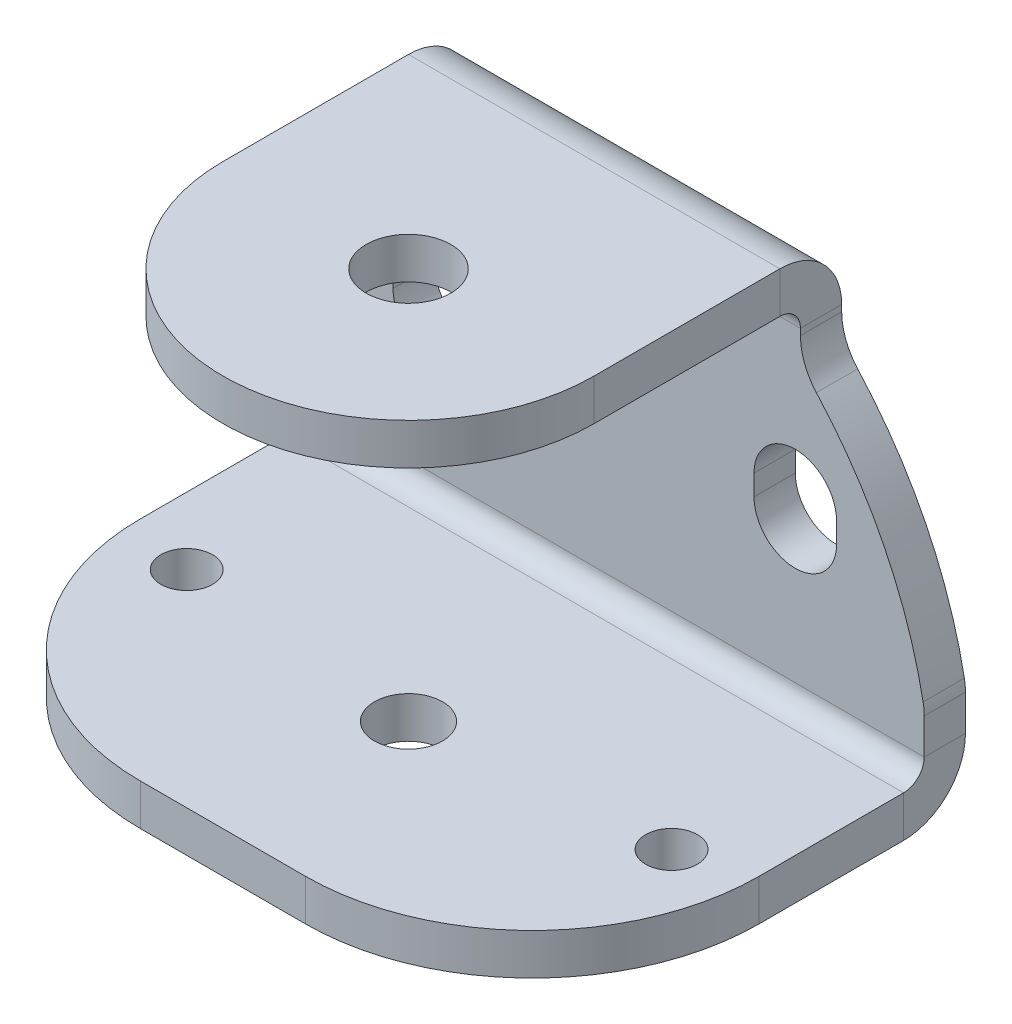
from build123d import *

# Parameters (mm, degrees)
BRIDA_BASE1_DEPTH                = 2
REDONDEO3MM_R                    = 3
BRIDA_DE_ARISTA1_STRIP_W         = 10
BRIDA_DE_ARISTA1_STRIP_H         = 2
BRIDA_DE_ARISTA1_STRIP_CUT_DEPTH = 30
BRIDA_DE_ARISTA1_DEPTH           = 30
BRIDA_DE_ARISTA2_STRIP_W         = 10
BRIDA_DE_ARISTA2_STRIP_H         = 2
BRIDA_DE_ARISTA2_STRIP_CUT_DEPTH = 18
BRIDA_DE_ARISTA2_DEPTH           = 18
BRIDA_START                      = 2
BRIDA_DE_ARISTA2_FLAT_DEPTH      = 2
CORTAR_EXTRUIR6_REACH            = 43.255
REDONDEO11MM_R                   = 11
TALADRO_ROSCADO_M32_D            = 2.5
TALADRO_ROSCADO_M32_DEPTH        = 20.65
TALADRO_ROSCADO_M32_TIP          = 0.751075774
CROQUIS41_R                      = 2.05
CORTAR_EXTRUIR9_DEPTH            = 2
TALADRO_ROSCADO_M41_D            = 3.3


# Sheet-metal steps are written as plain solids
with BuildPart() as part:
    # Croquis1 → Brida base1 (new body)
    with BuildSketch(Plane.XY):
        with BuildLine():
            Line((0, 0), (30, 0))
            Line((30, 0), (30, 3))
            ThreePointArc((30, 3), (27.886584846, 9.212566007), (24, 14.5))
            Line((24, 14.5), (24, 17))
            Line((24, 17), (6, 17))
            Line((6, 17), (6, 14.5))
            ThreePointArc((6, 14.5), (2.113415154, 9.212566007), (0, 3))
            Line((0, 3), (0, 0))
        make_face()
    extrude(amount=-BRIDA_BASE1_DEPTH)

    # Redondeo3mm
    redondeo3mm_edges = [part.edges().sort_by_distance(p)[0] for p in [
        (0, 3, -1),
        (6, 14.5, -1),
        (24, 14.5, -1),
        (30, 3, -1),
    ]]
    fillet(redondeo3mm_edges, radius=REDONDEO3MM_R)

    # Brida de arista1 strip (across the edge) → Brida de arista1 strip cut (cut)
    with BuildSketch(Plane.YZ):
        with Locations((-4, -1)):
            Rectangle(BRIDA_DE_ARISTA1_STRIP_W, BRIDA_DE_ARISTA1_STRIP_H)
    extrude(amount=BRIDA_DE_ARISTA1_STRIP_CUT_DEPTH, mode=Mode.SUBTRACT)

    # Brida de arista1 section (across the edge) → Brida de arista1 (add)
    with BuildSketch(Plane.YZ):
        with BuildLine():
            Line((-2, 1), (-2, 19))
            Line((-2, 19), (0, 19))
            Line((0, 19), (0, 1))
            ThreePointArc((0, 1), (0.292893219, 0.292893219), (1, 0))
            Line((1, 0), (1, -2))
            ThreePointArc((1, -2), (-1.121320344, -1.121320344), (-2, 1))
        make_face()
    extrude(amount=BRIDA_DE_ARISTA1_DEPTH)

    # Brida de arista2 strip (across the edge) → Brida de arista2 strip cut (cut)
    with BuildSketch(Plane(origin=(24, 17, 0), x_dir=(0, -1, 0), z_dir=(-1, 0, 0))):
        with Locations((-4, -1)):
            Rectangle(BRIDA_DE_ARISTA2_STRIP_W, BRIDA_DE_ARISTA2_STRIP_H)
    extrude(amount=BRIDA_DE_ARISTA2_STRIP_CUT_DEPTH, mode=Mode.SUBTRACT)

    # Brida de arista2 bend section (across the edge) → Brida de arista2 (add)
    with BuildSketch(Plane(origin=(24, 17, 0), x_dir=(0, -1, 0), z_dir=(-1, 0, 0))):
        with BuildLine():
            Line((-2, 1), (0, 1))
            ThreePointArc((0, 1), (0.292893219, 0.292893219), (1, 0))
            Line((1, 0), (1, -2))
            ThreePointArc((1, -2), (-1.121320344, -1.121320344), (-2, 1))
        make_face()
    extrude(amount=BRIDA_DE_ARISTA2_DEPTH)

    # Brida de arista2 profile (on flange) → Brida de arista2 flat (add)
    with BuildSketch(Plane(origin=(0, 17, 0), x_dir=(-1, 0, 0), z_dir=(0, 1, 0)).offset(BRIDA_START)):
        with BuildLine():
            ThreePointArc((-6, 10), (-15, 19), (-24, 10))
            Line((-24, 10), (-24, 1))
            Line((-24, 1), (-6, 1))
            Line((-6, 1), (-6, 10))
        make_face()
    extrude(amount=-BRIDA_DE_ARISTA2_FLAT_DEPTH)

    # Croquis26 → Cortar-Extruir6 (cut, up to next)
    with BuildSketch(Plane(origin=(0, 0, -2), x_dir=(-1, 0, 0), z_dir=(0, 0, -1)), mode=Mode.PRIVATE) as cortar_extruir6_sk1:
        with BuildLine():
            Line((-8.25, 7.8), (-8.25, 8.8))
            ThreePointArc((-8.25, 8.8), (-6.25, 10.8), (-4.25, 8.8))
            Line((-4.25, 8.8), (-4.25, 7.8))
            ThreePointArc((-4.25, 7.8), (-6.25, 5.8), (-8.25, 7.8))
        make_face()
    cortar_extruir6_tool1 = extrude(cortar_extruir6_sk1.sketch, amount=-CORTAR_EXTRUIR6_REACH, mode=Mode.PRIVATE) & part.part
    # Croquis26 → Cortar-Extruir6 (cut, up to next)
    with BuildSketch(Plane(origin=(0, 0, -2), x_dir=(-1, 0, 0), z_dir=(0, 0, -1)), mode=Mode.PRIVATE) as cortar_extruir6_sk2:
        with BuildLine():
            Line((-25.75, 7.8), (-25.75, 8.8))
            ThreePointArc((-25.75, 8.8), (-23.75, 10.8), (-21.75, 8.8))
            Line((-21.75, 8.8), (-21.75, 7.8))
            ThreePointArc((-21.75, 7.8), (-23.75, 5.8), (-25.75, 7.8))
        make_face()
    cortar_extruir6_tool2 = extrude(cortar_extruir6_sk2.sketch, amount=-CORTAR_EXTRUIR6_REACH, mode=Mode.PRIVATE) & part.part
    add(cortar_extruir6_tool1.solids().sort_by_distance((6.25, 8.3, -2))[0], mode=Mode.SUBTRACT)
    add(cortar_extruir6_tool2.solids().sort_by_distance((23.75, 8.3, -2))[0], mode=Mode.SUBTRACT)

    # Redondeo11mm
    redondeo11mm_edges = [part.edges().sort_by_distance(p)[0] for p in [
        (0, -1, 19),
        (30, -1, 19),
    ]]
    fillet(redondeo11mm_edges, radius=REDONDEO11MM_R)

    # Taladro roscado M32
    with Locations(Plane(origin=(0, 0, 0), x_dir=(1, 0, 0), z_dir=(0, 1, 0))):
        with Locations((3.25, -9), (26.75, -9)):
            Hole(TALADRO_ROSCADO_M32_D / 2, depth=TALADRO_ROSCADO_M32_DEPTH)
            with Locations((0, 0, -(TALADRO_ROSCADO_M32_DEPTH + TALADRO_ROSCADO_M32_TIP / 2))):  # 118° drill point
                Cone(0, TALADRO_ROSCADO_M32_D / 2, TALADRO_ROSCADO_M32_TIP, mode=Mode.SUBTRACT)

    # Croquis41 → Cortar-Extruir9 (cut)
    with BuildSketch(Plane(origin=(0, 19, 0), x_dir=(1, 0, 0), z_dir=(0, 1, 0))):
        with Locations(Location((15, -10, 0), (0, 0, 270))):
            Circle(CROQUIS41_R)
    extrude(amount=-CORTAR_EXTRUIR9_DEPTH, mode=Mode.SUBTRACT)

    # Taladro roscado M41 (through all)
    with Locations(Plane(origin=(15, 0, 10), x_dir=(0, 0, 1), z_dir=(0, 1, 0))):
        with Locations((0, 0)):
            Hole(TALADRO_ROSCADO_M41_D / 2)


solid = part.part
